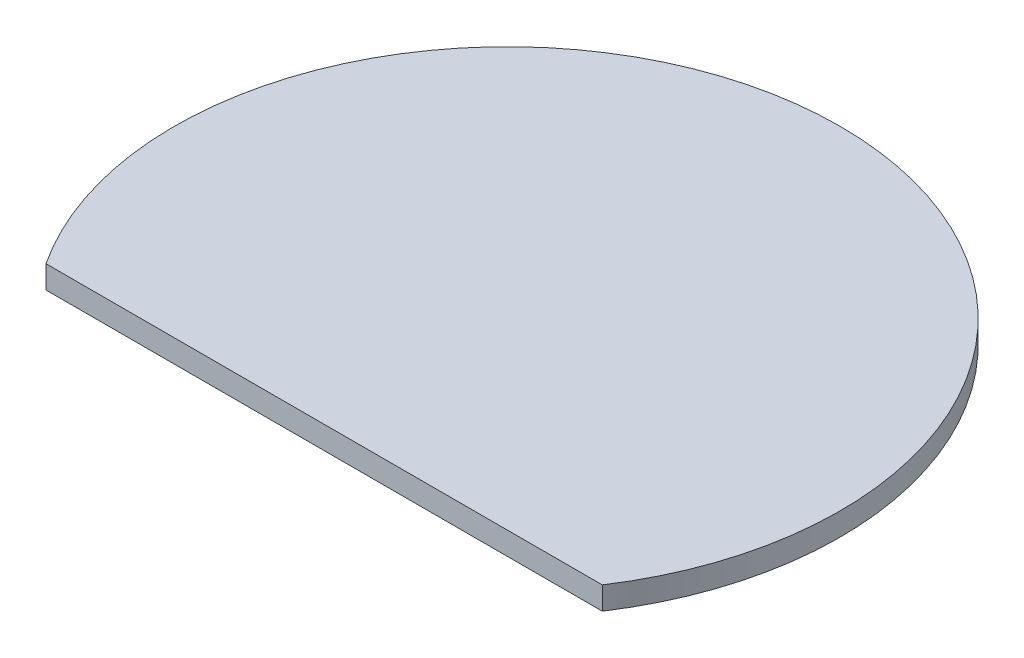
from build123d import *

# Parameters (mm, degrees)
BOSS_EXTRUDE1_DEPTH = 1


with BuildPart() as part:
    # Sketch1 → Boss-Extrude1 (new body)
    with BuildSketch(Plane(origin=(0, 0, 0), x_dir=(1, 0, 0), z_dir=(0, 1, 0))):
        with BuildLine():
            Line((-12.195, -8.027575911), (12.195, -8.027575911))
            ThreePointArc((12.195, -8.027575911), (0, 14.6), (-12.195, -8.027575911))
        make_face()
    extrude(amount=BOSS_EXTRUDE1_DEPTH)


solid = part.part
